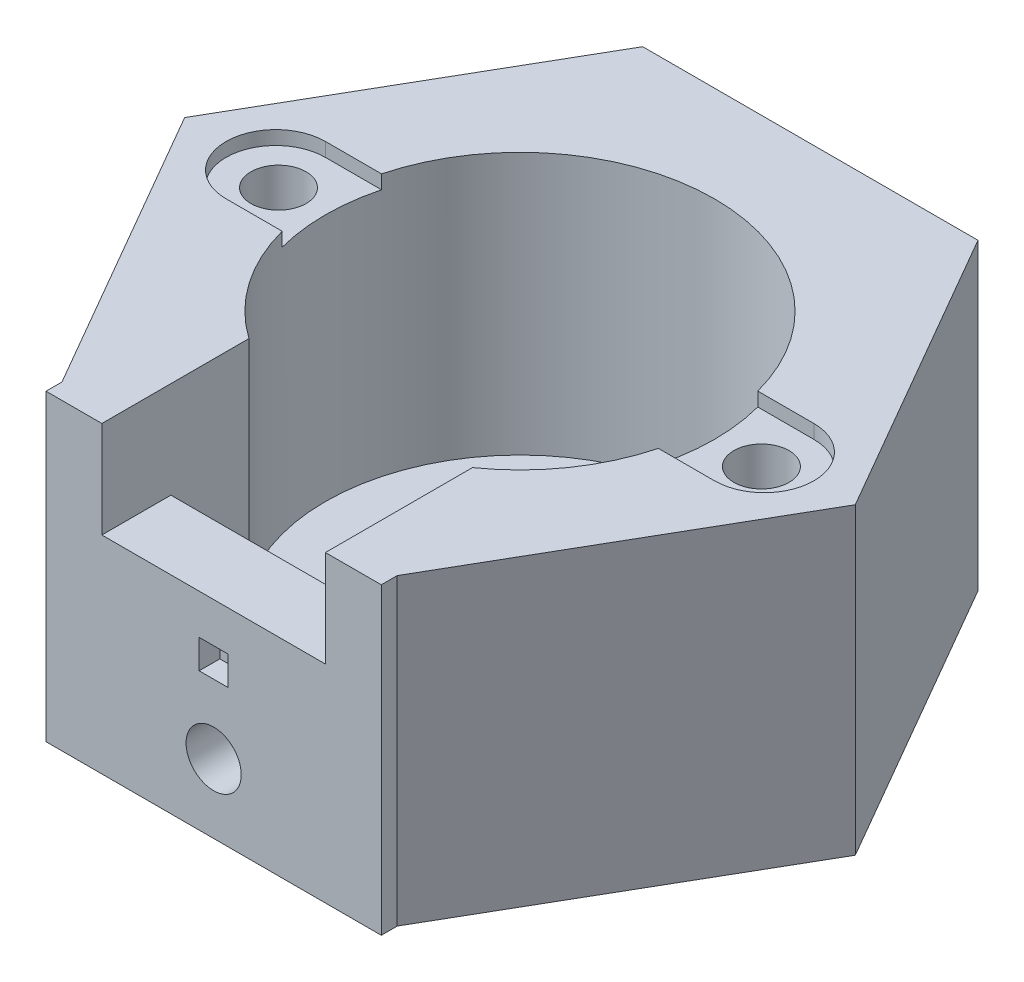
from build123d import *

# Parameters (mm, degrees)
BOSS_EXTRUDE12_DEPTH = 22
SKETCH1_14_R         = 2
BOSS_EXTRUDE13_DEPTH = 21
BOSS_EXTRUDE14_DEPTH = 3
BOSS_EXTRUDE15_DEPTH = 3
SKETCH1_17_W         = 16.2
SKETCH1_17_H         = 3.844417312
BOSS_EXTRUDE16_DEPTH = 15
SKETCH1_18_R         = 2
BOSS_EXTRUDE17_DEPTH = 18
SKETCH1_19_W         = 4.05
SKETCH1_19_H         = 1.155582688
BOSS_EXTRUDE18_DEPTH = 22
SKETCH1_20_W         = 16.2
SKETCH1_20_H         = 1.155582688
BOSS_EXTRUDE19_DEPTH = 15
SKETCH10_R           = 2
CUT_EXTRUDE6_DEPTH   = 3
SKETCH10_10_W        = 2.1
SKETCH10_10_H        = 2.1
CUT_EXTRUDE7_DEPTH   = 1.5


with BuildPart() as part:
    # Sketch1 → Boss-Extrude12 (new body)
    with BuildSketch(Plane(origin=(0, 0, 0), x_dir=(1, 0, 0), z_dir=(0, 1, 0))):
        with BuildLine():
            ThreePointArc((-17.7, -3.6), (-21.3, 0), (-17.7, 3.6))
            Line((-17.7, 3.6), (-13.632681321, 3.6))
            ThreePointArc((-13.632681321, 3.6), (0, 14.1), (13.632681321, 3.6))
            Line((13.632681321, 3.6), (17.7, 3.6))
            ThreePointArc((17.7, 3.6), (21.3, 0), (17.7, -3.6))
            Line((17.7, -3.6), (13.632681321, -3.6))
            ThreePointArc((13.632681321, -3.6), (11.569059796, -8.060201948), (8.1, -11.541230437))
            Line((8.1, -11.541230437), (8.1, -17.2))
            Line((8.1, -17.2), (8.1, -21.044417312))
            Line((8.1, -21.044417312), (12.15, -21.044417312))
            Line((12.15, -21.044417312), (24.3, 0))
            Line((24.3, 0), (12.15, 21.044417312))
            Line((12.15, 21.044417312), (-12.15, 21.044417312))
            Line((-12.15, 21.044417312), (-24.3, 0))
            Line((-24.3, 0), (-12.15, -21.044417312))
            Line((-12.15, -21.044417312), (-8.1, -21.044417312))
            Line((-8.1, -21.044417312), (-8.1, -17.2))
            Line((-8.1, -17.2), (-8.1, -11.541230437))
            ThreePointArc((-8.1, -11.541230437), (-11.569059796, -8.060201948), (-13.632681321, -3.6))
            Line((-13.632681321, -3.6), (-17.7, -3.6))
        make_face()
    extrude(amount=BOSS_EXTRUDE12_DEPTH)

    # Sketch1<14> → Boss-Extrude13 (add)
    # profile 1 of 2: a face of its own
    with BuildSketch(Plane(origin=(0, 0, 0), x_dir=(1, 0, 0), z_dir=(0, 1, 0))):
        with BuildLine():
            Line((-13.632681321, 3.6), (-17.7, 3.6))
            ThreePointArc((-17.7, 3.6), (-21.3, 0), (-17.7, -3.6))
            Line((-17.7, -3.6), (-13.632681321, -3.6))
            ThreePointArc((-13.632681321, -3.6), (-14.1, 0), (-13.632681321, 3.6))
        make_face()
        with Locations((-17.5, 0)):
            Circle(SKETCH1_14_R, mode=Mode.SUBTRACT)
    # profile 2 of 2: a face of its own
    with BuildSketch(Plane(origin=(0, 0, 0), x_dir=(1, 0, 0), z_dir=(0, 1, 0))):
        with BuildLine():
            Line((17.7, 3.6), (13.632681321, 3.6))
            ThreePointArc((13.632681321, 3.6), (14.1, 0), (13.632681321, -3.6))
            Line((13.632681321, -3.6), (17.7, -3.6))
            ThreePointArc((17.7, -3.6), (21.3, 0), (17.7, 3.6))
        make_face()
        with Locations((17.5, 0)):
            Circle(SKETCH1_14_R, mode=Mode.SUBTRACT)
    extrude(amount=BOSS_EXTRUDE13_DEPTH)

    # Sketch1<15> → Boss-Extrude14 (add)
    with BuildSketch(Plane(origin=(0, 0, 0), x_dir=(1, 0, 0), z_dir=(0, 1, 0))):
        with BuildLine():
            ThreePointArc((13.632681321, 3.6), (0, 14.1), (-13.632681321, 3.6))
            ThreePointArc((-13.632681321, 3.6), (-14.1, 0), (-13.632681321, -3.6))
            ThreePointArc((-13.632681321, -3.6), (-11.569059796, -8.060201948), (-8.1, -11.541230437))
            ThreePointArc((-8.1, -11.541230437), (0, -14.1), (8.1, -11.541230437))
            ThreePointArc((8.1, -11.541230437), (11.569059796, -8.060201948), (13.632681321, -3.6))
            ThreePointArc((13.632681321, -3.6), (13.982682265, -1.81510239), (14.1, 0))
            ThreePointArc((14.1, 0), (13.982682265, 1.81510239), (13.632681321, 3.6))
        make_face()
    extrude(amount=BOSS_EXTRUDE14_DEPTH)

    # Sketch1<16> → Boss-Extrude15 (add)
    with BuildSketch(Plane(origin=(0, 0, 0), x_dir=(1, 0, 0), z_dir=(0, 1, 0))):
        with BuildLine():
            ThreePointArc((8.1, -11.541230437), (0, -14.1), (-8.1, -11.541230437))
            Line((-8.1, -11.541230437), (-8.1, -17.2))
            Line((-8.1, -17.2), (8.1, -17.2))
            Line((8.1, -17.2), (8.1, -11.541230437))
        make_face()
    extrude(amount=BOSS_EXTRUDE15_DEPTH)

    # Sketch1<17> → Boss-Extrude16 (add)
    with BuildSketch(Plane(origin=(0, 0, 0), x_dir=(1, 0, 0), z_dir=(0, 1, 0))):
        with Locations((0, -19.122208656)):
            Rectangle(SKETCH1_17_W, SKETCH1_17_H)
    extrude(amount=BOSS_EXTRUDE16_DEPTH)

    # Sketch1<18> → Boss-Extrude17 (add)
    with BuildSketch(Plane(origin=(0, 0, 0), x_dir=(1, 0, 0), z_dir=(0, 1, 0))):
        with Locations((17.5, 0)):
            Circle(SKETCH1_18_R)
        with Locations((-17.5, 0)):
            Circle(SKETCH1_18_R)
    extrude(amount=BOSS_EXTRUDE17_DEPTH)

    # Sketch1<19> → Boss-Extrude18 (add)
    with BuildSketch(Plane(origin=(0, 0, 0), x_dir=(1, 0, 0), z_dir=(0, 1, 0))):
        with Locations((-10.125, -21.622208656)):
            Rectangle(SKETCH1_19_W, SKETCH1_19_H)
        with Locations((10.125, -21.622208656)):
            Rectangle(SKETCH1_19_W, SKETCH1_19_H)
    extrude(amount=BOSS_EXTRUDE18_DEPTH)

    # Sketch1<20> → Boss-Extrude19 (add)
    with BuildSketch(Plane(origin=(0, 0, 0), x_dir=(1, 0, 0), z_dir=(0, 1, 0))):
        with Locations((0, -21.622208656)):
            Rectangle(SKETCH1_20_W, SKETCH1_20_H)
    extrude(amount=BOSS_EXTRUDE19_DEPTH)

    # Sketch10 → Cut-Extrude6 (cut)
    with BuildSketch(Plane.XY.offset(22.2)):
        with Locations((0, 5)):
            Circle(SKETCH10_R)
    extrude(amount=-CUT_EXTRUDE6_DEPTH, mode=Mode.SUBTRACT)

    # Sketch10<10> → Cut-Extrude7 (cut)
    with BuildSketch(Plane.XY.offset(22.2)):
        with Locations((0, 11.05)):
            Rectangle(SKETCH10_10_W, SKETCH10_10_H)
    extrude(amount=-CUT_EXTRUDE7_DEPTH, mode=Mode.SUBTRACT)


solid = part.part
